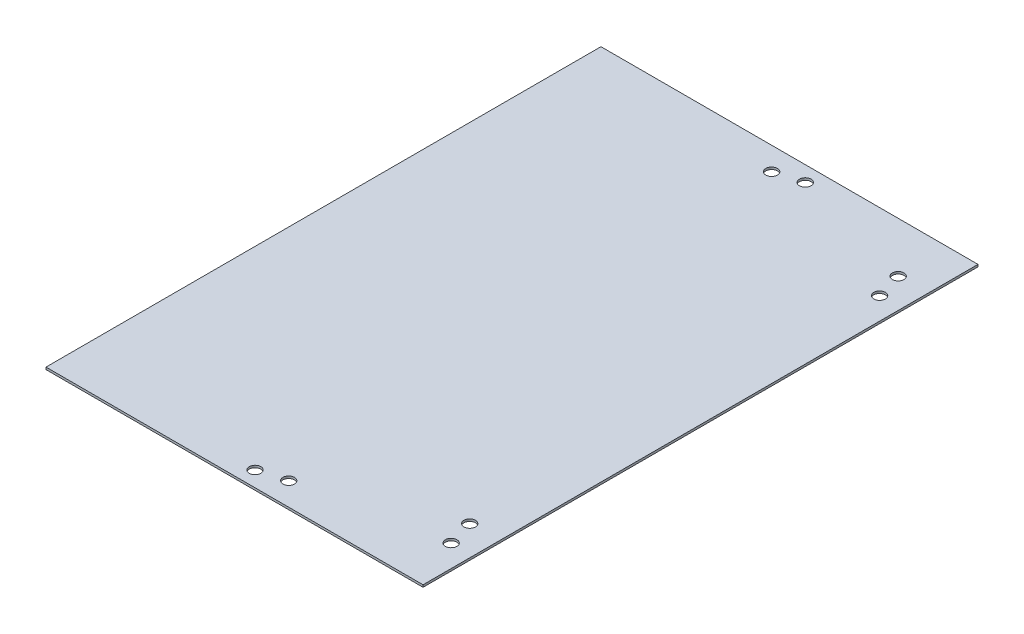
from build123d import *

# Parameters (mm, degrees)
SKETCH3_W           = 220
SKETCH3_H           = 323.8
BOSS_EXTRUDE1_DEPTH = 1.2954
CUT_EXTRUDE1_REACH  = 197.738
SKETCH4_R           = 3.3782


with BuildPart() as part:
    # Sketch3 → Boss-Extrude1 (new body)
    with BuildSketch(Plane(origin=(0, 0, 0), x_dir=(1, 0, 0), z_dir=(0, 1, 0))):
        Rectangle(SKETCH3_W, SKETCH3_H)
    extrude(amount=BOSS_EXTRUDE1_DEPTH)

    # Sketch4 → Cut-Extrude1 (cut, up to next)
    with BuildSketch(Plane(origin=(0, 1.2954, 0), x_dir=(1, 0, 0), z_dir=(0, 1, 0)), mode=Mode.PRIVATE) as cut_extrude1_sk1:
        with Locations((97.1046, -132.62)):
            Circle(SKETCH4_R)
    cut_extrude1_tool1 = extrude(cut_extrude1_sk1.sketch, amount=-CUT_EXTRUDE1_REACH, mode=Mode.PRIVATE) & part.part
    # Sketch4 → Cut-Extrude1 (cut, up to next)
    with BuildSketch(Plane(origin=(0, 1.2954, 0), x_dir=(1, 0, 0), z_dir=(0, 1, 0)), mode=Mode.PRIVATE) as cut_extrude1_sk2:
        with Locations((92.7046, -117.38)):
            Circle(SKETCH4_R)
    cut_extrude1_tool2 = extrude(cut_extrude1_sk2.sketch, amount=-CUT_EXTRUDE1_REACH, mode=Mode.PRIVATE) & part.part
    # Sketch4 → Cut-Extrude1 (cut, up to next)
    with BuildSketch(Plane(origin=(0, 1.2954, 0), x_dir=(1, 0, 0), z_dir=(0, 1, 0)), mode=Mode.PRIVATE) as cut_extrude1_sk3:
        with Locations((18.2246, -148.5)):
            Circle(SKETCH4_R)
    cut_extrude1_tool3 = extrude(cut_extrude1_sk3.sketch, amount=-CUT_EXTRUDE1_REACH, mode=Mode.PRIVATE) & part.part
    # Sketch4 → Cut-Extrude1 (cut, up to next)
    with BuildSketch(Plane(origin=(0, 1.2954, 0), x_dir=(1, 0, 0), z_dir=(0, 1, 0)), mode=Mode.PRIVATE) as cut_extrude1_sk4:
        with Locations((2.9846, -152.9)):
            Circle(SKETCH4_R)
    cut_extrude1_tool4 = extrude(cut_extrude1_sk4.sketch, amount=-CUT_EXTRUDE1_REACH, mode=Mode.PRIVATE) & part.part
    # Sketch4 → Cut-Extrude1 (cut, up to next)
    with BuildSketch(Plane(origin=(0, 1.2954, 0), x_dir=(1, 0, 0), z_dir=(0, 1, 0)), mode=Mode.PRIVATE) as cut_extrude1_sk5:
        with Locations((97.1046, 117.38)):
            Circle(SKETCH4_R)
    cut_extrude1_tool5 = extrude(cut_extrude1_sk5.sketch, amount=-CUT_EXTRUDE1_REACH, mode=Mode.PRIVATE) & part.part
    # Sketch4 → Cut-Extrude1 (cut, up to next)
    with BuildSketch(Plane(origin=(0, 1.2954, 0), x_dir=(1, 0, 0), z_dir=(0, 1, 0)), mode=Mode.PRIVATE) as cut_extrude1_sk6:
        with Locations((92.7046, 132.62)):
            Circle(SKETCH4_R)
    cut_extrude1_tool6 = extrude(cut_extrude1_sk6.sketch, amount=-CUT_EXTRUDE1_REACH, mode=Mode.PRIVATE) & part.part
    # Sketch4 → Cut-Extrude1 (cut, up to next)
    with BuildSketch(Plane(origin=(0, 1.2954, 0), x_dir=(1, 0, 0), z_dir=(0, 1, 0)), mode=Mode.PRIVATE) as cut_extrude1_sk7:
        with Locations((18.2246, 152.9)):
            Circle(SKETCH4_R)
    cut_extrude1_tool7 = extrude(cut_extrude1_sk7.sketch, amount=-CUT_EXTRUDE1_REACH, mode=Mode.PRIVATE) & part.part
    # Sketch4 → Cut-Extrude1 (cut, up to next)
    with BuildSketch(Plane(origin=(0, 1.2954, 0), x_dir=(1, 0, 0), z_dir=(0, 1, 0)), mode=Mode.PRIVATE) as cut_extrude1_sk8:
        with Locations((2.9846, 148.5)):
            Circle(SKETCH4_R)
    cut_extrude1_tool8 = extrude(cut_extrude1_sk8.sketch, amount=-CUT_EXTRUDE1_REACH, mode=Mode.PRIVATE) & part.part
    add(cut_extrude1_tool1.solids().sort_by_distance((97.1046, 1.2954, 132.62))[0], mode=Mode.SUBTRACT)
    add(cut_extrude1_tool2.solids().sort_by_distance((92.7046, 1.2954, 117.38))[0], mode=Mode.SUBTRACT)
    add(cut_extrude1_tool3.solids().sort_by_distance((18.2246, 1.2954, 148.5))[0], mode=Mode.SUBTRACT)
    add(cut_extrude1_tool4.solids().sort_by_distance((2.9846, 1.2954, 152.9))[0], mode=Mode.SUBTRACT)
    add(cut_extrude1_tool5.solids().sort_by_distance((97.1046, 1.2954, -117.38))[0], mode=Mode.SUBTRACT)
    add(cut_extrude1_tool6.solids().sort_by_distance((92.7046, 1.2954, -132.62))[0], mode=Mode.SUBTRACT)
    add(cut_extrude1_tool7.solids().sort_by_distance((18.2246, 1.2954, -152.9))[0], mode=Mode.SUBTRACT)
    add(cut_extrude1_tool8.solids().sort_by_distance((2.9846, 1.2954, -148.5))[0], mode=Mode.SUBTRACT)


solid = part.part
